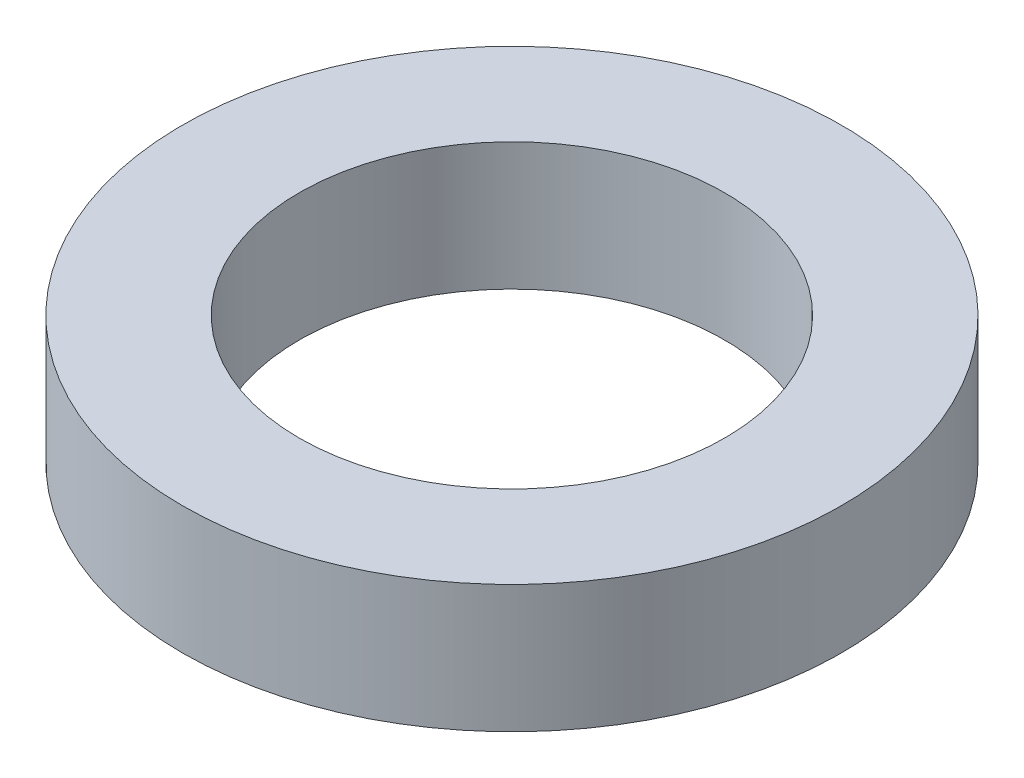
from build123d import *

# Parameters (mm, degrees)
SKETCH1_R           = 31
SKETCH1_R_2         = 20
BOSS_EXTRUDE1_DEPTH = 6


with BuildPart() as part:
    # Sketch1 → Boss-Extrude1 (new, symmetric)
    with BuildSketch(Plane(origin=(0, 0, 0), x_dir=(1, 0, 0), z_dir=(0, 1, 0))):
        Circle(SKETCH1_R)
        Circle(SKETCH1_R_2, mode=Mode.SUBTRACT)
    extrude(amount=BOSS_EXTRUDE1_DEPTH, both=True)


solid = part.part
